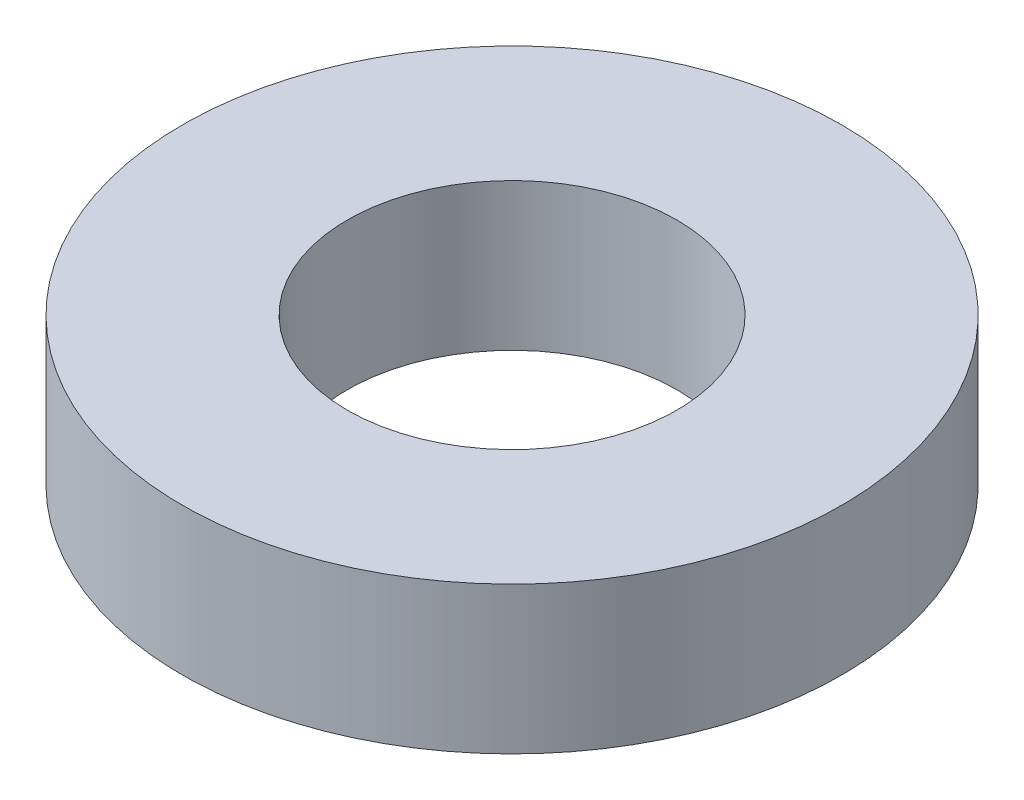
from build123d import *

# Parameters (mm, degrees)
SKETCH1_R           = 65
BOSS_EXTRUDE1_DEPTH = 29
SKETCH2_R           = 32.5
CUT_EXTRUDE1_DEPTH  = 97.389833489


with BuildPart() as part:
    # Sketch1 → Boss-Extrude1 (new body)
    with BuildSketch(Plane(origin=(0, 0, 0), x_dir=(1, 0, 0), z_dir=(0, 1, 0))):
        Circle(SKETCH1_R)
    extrude(amount=BOSS_EXTRUDE1_DEPTH)

    # Sketch2 → Cut-Extrude1 (cut, through all)
    with BuildSketch(Plane(origin=(0, 0, 0), x_dir=(1, 0, 0), z_dir=(0, 1, 0))):
        Circle(SKETCH2_R)
    extrude(amount=CUT_EXTRUDE1_DEPTH, mode=Mode.SUBTRACT)


solid = part.part
